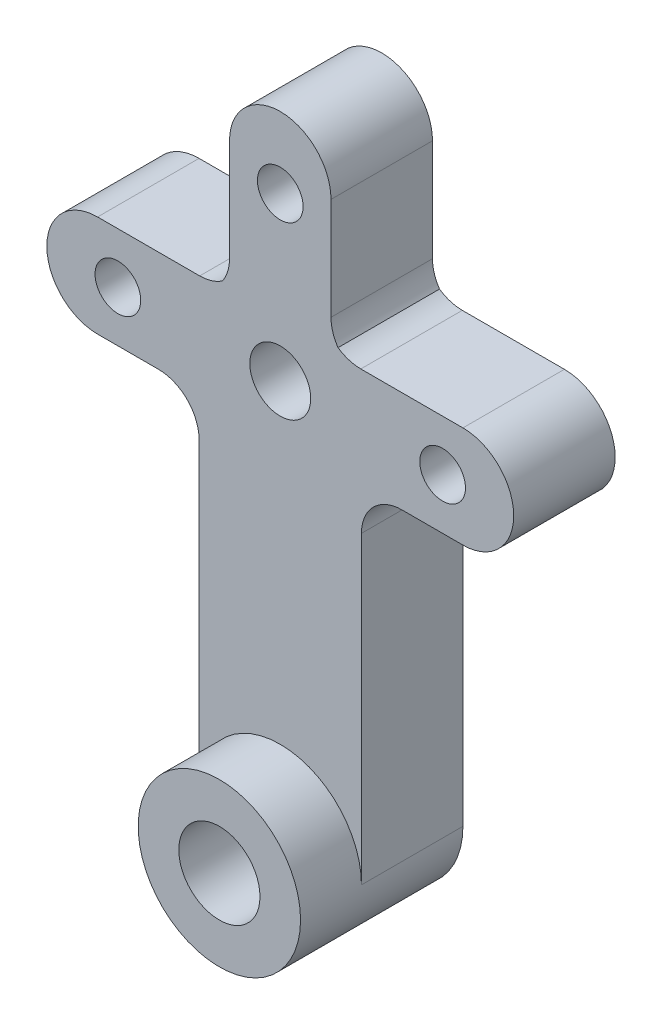
from build123d import *

# Parameters (mm, degrees)
ESQUISSE1_R             = 26.25
BOSS_EXTRU_1_DEPTH      = 5
ESQUISSE2_R             = 1.5
ENL_V_MAT_EXTRU_1_DEPTH = 5
ENL_V_START             = -5
ESQUISSE3_R             = 26.25
ESQUISSE3_R_2           = 2
ENL_V_MAT_EXTRU_2_DEPTH = 5
CONG_1_R                = 2
ESQUISSE4_R             = 1.125
ENL_V_MAT_EXTRU_3_DEPTH = 10
ESQUISSE5_R             = 4
ESQUISSE5_R_2           = 2
BOSS_EXTRU_2_DEPTH      = 3


with BuildPart() as part:
    # Esquisse1 → Boss.-Extru.1 (new body)
    with BuildSketch(Plane.XY):
        Circle(ESQUISSE1_R)
    extrude(amount=BOSS_EXTRU_1_DEPTH)

    # Esquisse2 → Enlèv. mat.-Extru.1 (cut)
    with BuildSketch(Plane.XY.offset(5)):
        Circle(ESQUISSE2_R)
    extrude(amount=-ENL_V_MAT_EXTRU_1_DEPTH, mode=Mode.SUBTRACT)

    # Esquisse3 → Enlèv. mat.-Extru.2 (cut)
    # profile 1 of 2: a face of its own
    with BuildSketch(Plane.XY.offset(5).offset(ENL_V_START)):
        Circle(ESQUISSE3_R)
        with BuildLine():
            Line((9, -2.5), (4, -2.5))
            Line((4, -2.5), (4, -19.5))
            ThreePointArc((4, -19.5), (0, -23.5), (-4, -19.5))
            Line((-4, -19.5), (-4, -2.5))
            Line((-4, -2.5), (-9, -2.5))
            ThreePointArc((-9, -2.5), (-11.5, 0), (-9, 2.5))
            Line((-9, 2.5), (-3.122498999, 2.5))
            ThreePointArc((-3.122498999, 2.5), (-2.828427125, 2.828427125), (-2.5, 3.122498999))
            Line((-2.5, 3.122498999), (-2.5, 9))
            ThreePointArc((-2.5, 9), (0, 11.5), (2.5, 9))
            Line((2.5, 9), (2.5, 3.122498999))
            ThreePointArc((2.5, 3.122498999), (2.828427125, 2.828427125), (3.122498999, 2.5))
            Line((3.122498999, 2.5), (9, 2.5))
            ThreePointArc((9, 2.5), (11.5, 0), (9, -2.5))
        make_face(mode=Mode.SUBTRACT)
    # profile 2 of 2: a face of its own
    with BuildSketch(Plane.XY.offset(5).offset(ENL_V_START)):
        with Locations((0, -19.5)):
            Circle(ESQUISSE3_R_2)
    extrude(amount=ENL_V_MAT_EXTRU_2_DEPTH, mode=Mode.SUBTRACT)

    # Congé1
    # the kernel refuses this fillet: 2 mm, written as the material it adds along each edge
    with BuildSketch(Plane(origin=(-4, -2.5, 0), x_dir=(0, -1, 0), z_dir=(0, 0, 1)), Plane(origin=(4, -2.5, 0), x_dir=(1, 0, 0), z_dir=(0, 0, 1))) as cong_1_piece_1:
        with BuildLine():
            CenterArc((CONG_1_R, -CONG_1_R), CONG_1_R, 90, 90)
            Line((0, -CONG_1_R), (0, 0))
            Line((0, 0), (CONG_1_R, 0))
        make_face()
    extrude(amount=5)
    with BuildSketch(Plane(origin=(-3.122498999, 2.5, 0), x_dir=(-1, 0, 0), z_dir=(0, 0, 1))) as cong_1_piece_2:
        with BuildLine():
            CenterArc((0.846127967, -2), CONG_1_R, 90, 41.409622109)
            ThreePointArc((-0.476747688, -0.5), (-0.227558946, -0.260311955), (0, 0))
            Line((0, 0), (0.846127967, 0))
        make_face()
    extrude(amount=5)
    with BuildSketch(Plane(origin=(-2.5, 3.122498999, 0), x_dir=(-0.7237350132500174, -0.6900779887780779, 0), z_dir=(0, 0, 1)), Plane(origin=(3.122498999, 2.5, 0), x_dir=(-0.6900779887780603, 0.7237350132500343, 0), z_dir=(0, 0, 1))) as cong_1_piece_3:
        with BuildLine():
            CenterArc((0.863575741, -1.992528413), CONG_1_R, 94.954095219, 41.409622109)
            Line((-0.583894286, -0.612372436), (0, 0))
            ThreePointArc((0, 0), (0.345430296, -0.014943173), (0.690860592, 0))
        make_face()
    extrude(amount=5)
    with BuildSketch(Plane(origin=(2.5, 3.122498999, 0), x_dir=(0.7237350132500171, -0.6900779887780782, 0), z_dir=(0, 0, 1))) as cong_1_piece_4:
        with BuildLine():
            CenterArc((0.863575741, 1.992528413), CONG_1_R, 223.636282672, 41.409622109)
            Line((-0.583894286, 0.612372436), (0, 0))
            ThreePointArc((0, 0), (0.345430296, 0.014943173), (0.690860592, 0))
        make_face()
    extrude(amount=5)

    # Esquisse4 → Enlèv. mat.-Extru.3 (cut)
    with BuildSketch(Plane.XY.offset(5)):
        with Locations((8, 0)):
            Circle(ESQUISSE4_R)
        with Locations((-8, 0)):
            Circle(ESQUISSE4_R)
        with Locations((0, 8)):
            Circle(ESQUISSE4_R)
    extrude(amount=-ENL_V_MAT_EXTRU_3_DEPTH, mode=Mode.SUBTRACT)

    # Esquisse5 → Boss.-Extru.2 (add)
    with BuildSketch(Plane.XY.offset(5)):
        with Locations((0, -19.5)):
            Circle(ESQUISSE5_R)
        with Locations((0, -19.5)):
            Circle(ESQUISSE5_R_2, mode=Mode.SUBTRACT)
    extrude(amount=BOSS_EXTRU_2_DEPTH)


solid = part.part
